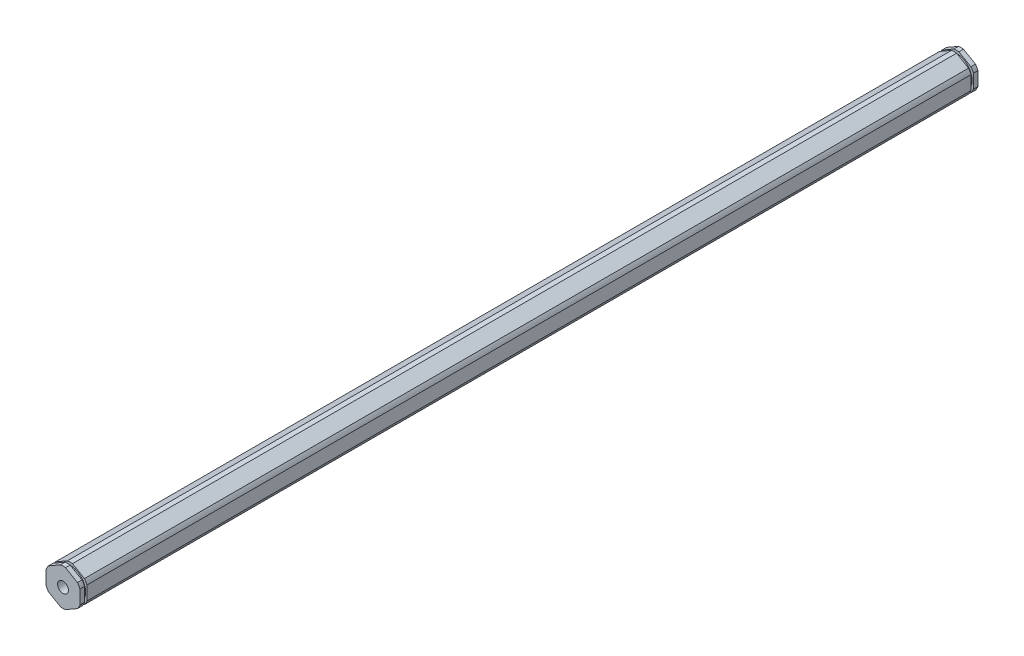
from build123d import *

# Parameters (mm, degrees)
BOSS_EXTRUDE1_DEPTH                  = 167.767
F_10_32_TAPPED_HOLE1_D               = 4.0386
F_10_32_TAPPED_HOLE1_DEPTH           = 16.34744
F_10_32_TAPPED_HOLE1_TIP             = 1.213317848
F_10_32_TAPPED_HOLE1_ON_FACE_2_D     = 4.0386
F_10_32_TAPPED_HOLE1_ON_FACE_2_DEPTH = 16.34744
F_10_32_TAPPED_HOLE1_ON_FACE_2_TIP   = 1.213317848
SKETCH5_W                            = 0.889
SKETCH5_H                            = 1.0033


with BuildPart() as part:
    # Sketch1 → Boss-Extrude1 (new, symmetric)
    with BuildSketch(Plane.XY):
        with BuildLine():
            ThreePointArc((0.93173274, 6.79441227), (0, 6.858), (-0.93173274, 6.79441227))
            Line((-0.93173274, 6.79441227), (-5.41826726, 4.204110358))
            ThreePointArc((-5.41826726, 4.204110358), (-5.939202219, 3.429), (-6.35, 2.590301913))
            Line((-6.35, 2.590301913), (-6.35, -2.590301913))
            ThreePointArc((-6.35, -2.590301913), (-5.939202219, -3.429), (-5.41826726, -4.204110358))
            Line((-5.41826726, -4.204110358), (-0.93173274, -6.79441227))
            ThreePointArc((-0.93173274, -6.79441227), (0, -6.858), (0.93173274, -6.79441227))
            Line((0.93173274, -6.79441227), (5.41826726, -4.204110358))
            ThreePointArc((5.41826726, -4.204110358), (5.939202219, -3.429), (6.35, -2.590301913))
            Line((6.35, -2.590301913), (6.35, 2.590301913))
            ThreePointArc((6.35, 2.590301913), (5.939202219, 3.429), (5.41826726, 4.204110358))
            Line((5.41826726, 4.204110358), (0.93173274, 6.79441227))
        make_face()
    extrude(amount=BOSS_EXTRUDE1_DEPTH, both=True)

    # #10-32 Tapped Hole1
    with Locations(Plane.XY.offset(167.767)):
        with Locations((0, 0)):
            Hole(F_10_32_TAPPED_HOLE1_D / 2, depth=F_10_32_TAPPED_HOLE1_DEPTH)
            with Locations((0, 0, -(F_10_32_TAPPED_HOLE1_DEPTH + F_10_32_TAPPED_HOLE1_TIP / 2))):  # 118° drill point
                Cone(0, F_10_32_TAPPED_HOLE1_D / 2, F_10_32_TAPPED_HOLE1_TIP, mode=Mode.SUBTRACT)

    # #10-32 Tapped Hole1 on face 2
    with Locations(Plane(origin=(0, 0, -167.767), x_dir=(-1, 0, 0), z_dir=(0, 0, -1))):
        with Locations((0, 0)):
            Hole(F_10_32_TAPPED_HOLE1_ON_FACE_2_D / 2, depth=F_10_32_TAPPED_HOLE1_ON_FACE_2_DEPTH)
            with Locations((0, 0, -(F_10_32_TAPPED_HOLE1_ON_FACE_2_DEPTH + F_10_32_TAPPED_HOLE1_ON_FACE_2_TIP / 2))):  # 118° drill point
                Cone(0, F_10_32_TAPPED_HOLE1_ON_FACE_2_D / 2, F_10_32_TAPPED_HOLE1_ON_FACE_2_TIP, mode=Mode.SUBTRACT)

    # Sketch5 → Cut-Revolve1 (revolve, cut)
    with BuildSketch(Plane(origin=(0, 0, 0), x_dir=(0, 0, -1), z_dir=(1, 0, 0))):
        with Locations((-165.608, 6.35635)):
            Rectangle(SKETCH5_W, SKETCH5_H)
    cut_revolve1 = revolve(axis=Axis((0, 0, 165.047176272), (0, 0, -1)), mode=Mode.SUBTRACT)

    # Mirror1: Cut-Revolve1 across plane
    add(cut_revolve1.mirror(Plane.XY), mode=Mode.SUBTRACT)


solid = part.part
